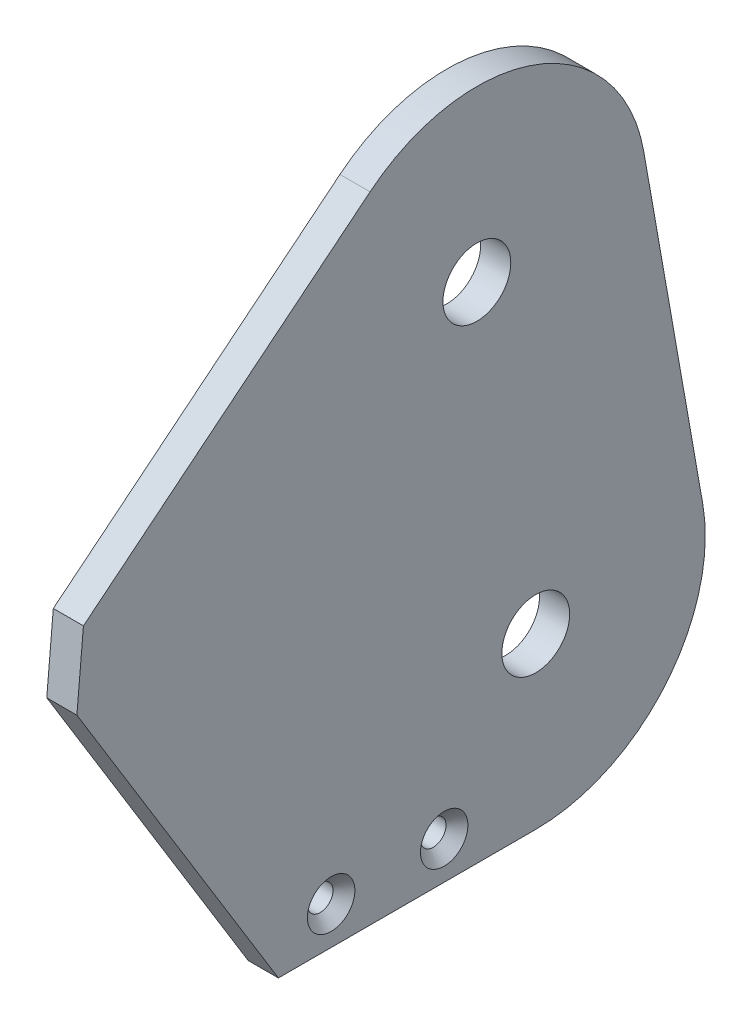
from build123d import *

# Parameters (mm, degrees)
BOSS_EXTRUDE1_DEPTH                             = 4
HOLE1_D                                         = 9
HOLE1_DEPTH                                     = 100
CSK_FOR_M3_FLAT_HEAD_MACHINE_SCREW1_D           = 3.4
CSK_FOR_M3_FLAT_HEAD_MACHINE_SCREW1_CSINK_D     = 6.3
CSK_FOR_M3_FLAT_HEAD_MACHINE_SCREW1_CSINK_ANGLE = 90


with BuildPart() as part:
    # Sketch2 → Boss-Extrude1 (new body)
    with BuildSketch(Plane(origin=(25, 0, 0), x_dir=(0, 0, -1), z_dir=(1, 0, 0))):
        with BuildLine():
            Line((26.501319495, 109.223432883), (34.31548749, 64.907083998))
            ThreePointArc((34.31548749, 64.907083998), (29.393313017, 46.537278782), (12.157313047, 38.5))
            Line((12.157313047, 38.5), (-22, 38.5))
            Line((-22, 38.5), (-48.74840947, 82.082529594))
            Line((-48.74840947, 82.082529594), (-47.879285155, 91.918154789))
            Line((-47.879285155, 91.918154789), (-9.833581443, 122.788338637))
            ThreePointArc((-9.833581443, 122.788338637), (12.212550675, 126.395306524), (26.501319495, 109.223432883))
        make_face()
    extrude(amount=BOSS_EXTRUDE1_DEPTH)

    # Hole1
    with Locations(Plane.ZY.offset(-25)):
        with Locations((-4.343145052, 105.316348886), (-12.157313047, 61)):
            Hole(HOLE1_D / 2, depth=HOLE1_DEPTH)

    # CSK for M3 Flat Head Machine Screw1 (through all)
    with Locations(Plane(origin=(29, 0, 0), x_dir=(0, 0, -1), z_dir=(1, 0, 0))):
        with Locations((0, 43.5), (-15, 43.5)):
            CounterSinkHole(CSK_FOR_M3_FLAT_HEAD_MACHINE_SCREW1_D / 2, CSK_FOR_M3_FLAT_HEAD_MACHINE_SCREW1_CSINK_D / 2, counter_sink_angle=CSK_FOR_M3_FLAT_HEAD_MACHINE_SCREW1_CSINK_ANGLE)


solid = part.part
